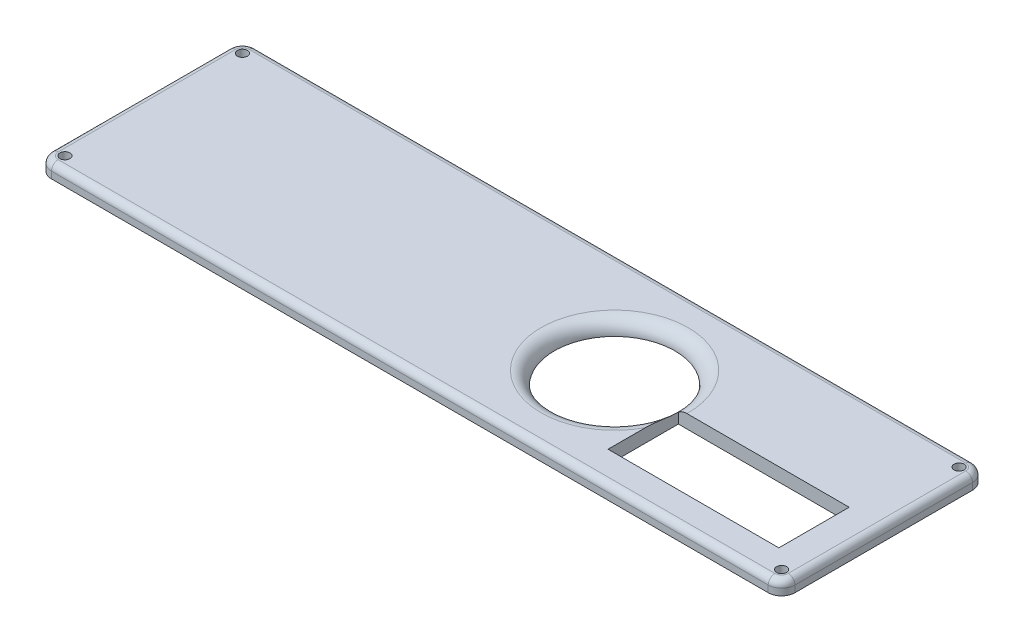
from build123d import *

# Parameters (mm, degrees)
SKETCH1_W           = 111
SKETCH1_H           = 30.5
BOSS_EXTRUDE1_DEPTH = 2
SKETCH2_R           = 0.75
SKETCH2_R_2         = 9
SKETCH2_W           = 25.5
SKETCH2_H           = 10.5
CUT_EXTRUDE1_DEPTH  = 116.131446616
FILLET1_R           = 1
FILLET2_R           = 2


with BuildPart() as part:
    # Sketch1 → Boss-Extrude1 (new body)
    with BuildSketch(Plane(origin=(0, 0, 0), x_dir=(1, 0, 0), z_dir=(0, 1, 0))):
        with Locations((55.5, 15.25)):
            Rectangle(SKETCH1_W, SKETCH1_H)
    extrude(amount=BOSS_EXTRUDE1_DEPTH)

    # Sketch2 → Cut-Extrude1 (cut, through all)
    with BuildSketch(Plane(origin=(0, 2, 0), x_dir=(1, 0, 0), z_dir=(0, 1, 0))):
        with Locations(Location((2, 28.5, 0), (0, 0, 270))):
            Circle(SKETCH2_R)
        with Locations(Location((2, 2, 0), (0, 0, 270))):
            Circle(SKETCH2_R)
        with Locations(Location((109, 2, 0), (0, 0, 270))):
            Circle(SKETCH2_R)
        with Locations(Location((109, 28.5, 0), (0, 0, 270))):
            Circle(SKETCH2_R)
        with Locations(Location((70.76, 15.31, 0), (0, 0, 270))):
            Circle(SKETCH2_R_2)
        with Locations((93.24, 9.85)):
            Rectangle(SKETCH2_W, SKETCH2_H)
    extrude(amount=-CUT_EXTRUDE1_DEPTH, mode=Mode.SUBTRACT)

    # Fillet1
    fillet1_edges = [part.edges().sort_by_distance(p)[0] for p in [
        (111, 2, -15.25),
        (55.5, 2, -30.5),
        (0, 2, -15.25),
        (55.5, 2, 0),
    ]]
    fillet(fillet1_edges, radius=FILLET1_R)

    # Fillet2
    # the kernel refuses this fillet: 2 mm, written as the material it takes off along each edge
    with BuildSketch(Plane(origin=(109, 2, -2), x_dir=(0, 0, 1), z_dir=(-1, 0, 0))) as fillet2_piece_1:
        with BuildLine():
            CenterArc((1, -1), 1, 0, 90)
            Line((2, -1), (2, 0))
            Line((2, 0), (1, 0))
        make_face()
    revolve(axis=Axis((109, 2, -2), (0, 1, 0)), revolution_arc=90, mode=Mode.SUBTRACT)
    with BuildSketch(Plane(origin=(2, 2, -2), x_dir=(-1, 0, 0), z_dir=(0, 0, -1))) as fillet2_piece_2:
        with BuildLine():
            CenterArc((1, -1), 1, 0, 90)
            Line((2, -1), (2, 0))
            Line((2, 0), (1, 0))
        make_face()
    revolve(axis=Axis((2, 2, -2), (0, 1, 0)), revolution_arc=90, mode=Mode.SUBTRACT)
    with BuildSketch(Plane(origin=(109, 2, -28.5), x_dir=(1, 0, 0), z_dir=(0, 0, 1))) as fillet2_piece_3:
        with BuildLine():
            CenterArc((1, -1), 1, 0, 90)
            Line((2, -1), (2, 0))
            Line((2, 0), (1, 0))
        make_face()
    revolve(axis=Axis((109, 2, -28.5), (0, 1, 0)), revolution_arc=90, mode=Mode.SUBTRACT)
    with BuildSketch(Plane(origin=(2, 2, -28.5), x_dir=(0, 0, -1), z_dir=(1, 0, 0))) as fillet2_piece_4:
        with BuildLine():
            CenterArc((1, -1), 1, 0, 90)
            Line((2, -1), (2, 0))
            Line((2, 0), (1, 0))
        make_face()
    revolve(axis=Axis((2, 2, -28.5), (0, 1, 0)), revolution_arc=90, mode=Mode.SUBTRACT)
    with BuildSketch(Plane(origin=(70.76, 2, -15.31), x_dir=(0, 0, 1), z_dir=(-1, 0, 0))) as fillet2_piece_5:
        with BuildLine():
            CenterArc((9 + FILLET2_R, -FILLET2_R), FILLET2_R, 90, 90)
            Line((9, -FILLET2_R), (9, 0))
            Line((9, 0), (9 + FILLET2_R, 0))
        make_face()
    revolve(axis=Axis((70.76, 2, -15.31), (0, 1, 0)), mode=Mode.SUBTRACT)
    with BuildSketch(Plane(origin=(0, -5, -30.5), x_dir=(0, 0, 1), z_dir=(0, 1, 0)), Plane(origin=(0, -5, 0), x_dir=(1, 0, 0), z_dir=(0, 1, 0))) as fillet2_piece_6:
        with BuildLine():
            CenterArc((FILLET2_R, FILLET2_R), FILLET2_R, 180, 90)
            Line((0, FILLET2_R), (0, 0))
            Line((0, 0), (FILLET2_R, 0))
        make_face()
    extrude(amount=7, mode=Mode.SUBTRACT)
    with BuildSketch(Plane(origin=(111, -5, -30.5), x_dir=(0, 0, 1), z_dir=(0, 1, 0)), Plane(origin=(111, -5, 0), x_dir=(-1, 0, 0), z_dir=(0, 1, 0))) as fillet2_piece_7:
        with BuildLine():
            CenterArc((FILLET2_R, -FILLET2_R), FILLET2_R, 90, 90)
            Line((0, -FILLET2_R), (0, 0))
            Line((0, 0), (FILLET2_R, 0))
        make_face()
    extrude(amount=7, mode=Mode.SUBTRACT)


solid = part.part
